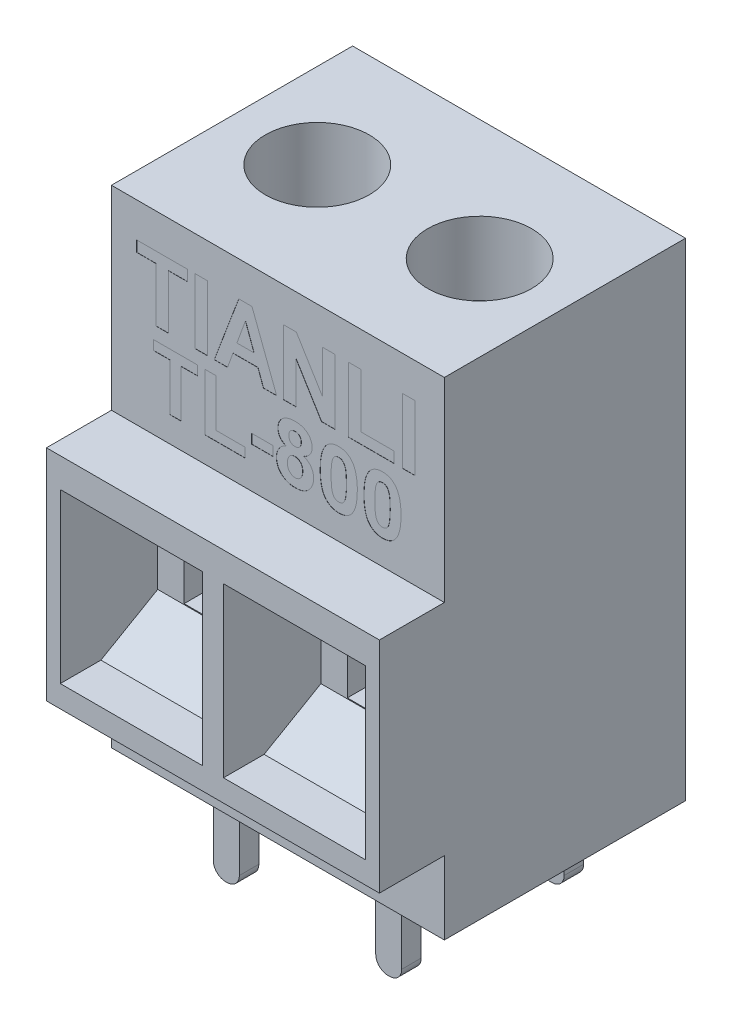
from build123d import *
from OCP.BRepFilletAPI import BRepFilletAPI_MakeChamfer

# Parameters (mm, degrees)
BOSS_EXTRUDE1_DEPTH     = 10.25
SKETCH2_W               = 8.75
SKETCH2_H               = 10.35
CUT_EXTRUDE1_DEPTH      = 6
SKETCH4_W               = 5.5
SKETCH4_H               = 6.2
CUT_EXTRUDE2_DEPTH      = 6
CHAMFER1_SIZE           = 3.5
CHAMFER1_SIZE2          = 2.020725942
SKETCH5_R               = 3.2
CUT_EXTRUDE3_DEPTH      = 4.5
SKETCH6_W               = 4.444559532
SKETCH6_H               = 1
SKETCH6_W_2             = 1
SKETCH6_H_2             = 3.5
CUT_EXTRUDE_THIN1_DEPTH = 1.5
SKETCH7_W               = 1.6
SKETCH7_H               = 1.2
BOSS_EXTRUDE2_DEPTH     = 5.45
FILLET1_R               = 0.75
SKETCH8_W               = 0.76923077
SKETCH8_H               = 4
SKETCH8_W_2             = 0.769230769
SKETCH8_W_3             = 1.301282051
SKETCH8_H_2             = 0.583333333
CUT_EXTRUDE4_DEPTH      = 0.01


with BuildPart() as part:
    # Sketch1 → Boss-Extrude1 (new, symmetric)
    with BuildSketch(Plane(origin=(0, 0, 0), x_dir=(0, 0, -1), z_dir=(1, 0, 0))):
        Polygon((7.425, 15), (-7.425, 15), (-7.425, 3), (-11.425, 3), (-11.425, -10.5), (-7.425, -10.5), (-7.425, -15), (7.425, -15), align=None)
    extrude(amount=BOSS_EXTRUDE1_DEPTH, both=True)

    # Sketch2 → Cut-Extrude1 (cut)
    with BuildSketch(Plane.XY.offset(11.425)):
        with Locations((5.025, -3.975)):
            Rectangle(SKETCH2_W, SKETCH2_H)
        with Locations((-5.025, -3.975)):
            Rectangle(SKETCH2_W, SKETCH2_H)
    extrude(amount=-CUT_EXTRUDE1_DEPTH, mode=Mode.SUBTRACT)

    # Sketch4 → Cut-Extrude2 (cut)
    with BuildSketch(Plane.XY.offset(5.425)):
        with Locations((-5.025, -3.975)):
            Rectangle(SKETCH4_W, SKETCH4_H)
        with Locations((5.025, -3.975)):
            Rectangle(SKETCH4_W, SKETCH4_H)
    extrude(amount=-CUT_EXTRUDE2_DEPTH, mode=Mode.SUBTRACT)

    # Chamfer1: one chamfer whose edges measure the first distance from different faces: ONE call of the kernel's chamfer builder (chamfer() names one face for all edges)
    chamfer1_edges_1 = [part.edges().sort_by_distance(p)[0] for p in [
        (5.025, -9.15, 5.425),
    ]]
    chamfer1_side_1 = [part.faces().sort_by_distance(p)[0] for p in [
        (5.025, -9.15, 8.425),
    ]]
    chamfer1_edges_2 = [part.edges().sort_by_distance(p)[0] for p in [
        (5.025, 1.2, 5.425),
    ]]
    chamfer1_side_2 = [part.faces().sort_by_distance(p)[0] for p in [
        (5.025, 1.2, 8.425),
    ]]
    chamfer1_edges_3 = [part.edges().sort_by_distance(p)[0] for p in [
        (-5.025, 1.2, 5.425),
    ]]
    chamfer1_side_3 = [part.faces().sort_by_distance(p)[0] for p in [
        (-5.025, 1.2, 8.425),
    ]]
    chamfer1_edges_4 = [part.edges().sort_by_distance(p)[0] for p in [
        (-5.025, -9.15, 5.425),
    ]]
    chamfer1_side_4 = [part.faces().sort_by_distance(p)[0] for p in [
        (-5.025, -9.15, 8.425),
    ]]
    chamfer1 = BRepFilletAPI_MakeChamfer(part.part.solid().wrapped)
    for e in chamfer1_edges_1:
        chamfer1.Add(CHAMFER1_SIZE, CHAMFER1_SIZE2, e.wrapped, chamfer1_side_1[0].wrapped)  # the first distance lies on this face
    for e in chamfer1_edges_2:
        chamfer1.Add(CHAMFER1_SIZE, CHAMFER1_SIZE2, e.wrapped, chamfer1_side_2[0].wrapped)  # the first distance lies on this face
    for e in chamfer1_edges_3:
        chamfer1.Add(CHAMFER1_SIZE, CHAMFER1_SIZE2, e.wrapped, chamfer1_side_3[0].wrapped)  # the first distance lies on this face
    for e in chamfer1_edges_4:
        chamfer1.Add(CHAMFER1_SIZE, CHAMFER1_SIZE2, e.wrapped, chamfer1_side_4[0].wrapped)  # the first distance lies on this face
    add(Compound.cast(chamfer1.Shape()), mode=Mode.REPLACE)

    # Sketch5 → Cut-Extrude3 (cut)
    with BuildSketch(Plane(origin=(0, 15, 0), x_dir=(1, 0, 0), z_dir=(0, 1, 0))):
        with Locations((-5, 0)):
            Circle(SKETCH5_R)
        with Locations((5, 0)):
            Circle(SKETCH5_R)
    extrude(amount=-CUT_EXTRUDE3_DEPTH, mode=Mode.SUBTRACT)

    # Sketch6 → Cut-Extrude-Thin1 (cut)
    with BuildSketch(Plane(origin=(0, 10.5, 0), x_dir=(1, 0, 0), z_dir=(0, 1, 0))):
        with Locations((-5, 0)):
            Rectangle(SKETCH6_W, SKETCH6_H)
        with Locations((-5, 0)):
            Rectangle(SKETCH6_W_2, SKETCH6_H_2)
        with Locations((5, 0)):
            Rectangle(SKETCH6_W_2, SKETCH6_H_2)
        with Locations((5, 0)):
            Rectangle(SKETCH6_W, SKETCH6_H)
    extrude(amount=-CUT_EXTRUDE_THIN1_DEPTH, mode=Mode.SUBTRACT)

    # Sketch7 → Boss-Extrude2 (add)
    with BuildSketch(Plane.XZ.offset(15)):
        with Locations((-5, 5)):
            Rectangle(SKETCH7_W, SKETCH7_H)
        with Locations((5, 5)):
            Rectangle(SKETCH7_W, SKETCH7_H)
        with Locations((-5, -5)):
            Rectangle(SKETCH7_W, SKETCH7_H)
        with Locations((5, -5)):
            Rectangle(SKETCH7_W, SKETCH7_H)
    extrude(amount=BOSS_EXTRUDE2_DEPTH)

    # Fillet1
    fillet1_edges = [part.edges().sort_by_distance(p)[0] for p in [
        (4.2, -20.45, -5),
        (5.8, -20.45, -5),
        (-4.2, -20.45, -5),
        (-5.8, -20.45, -5),
        (-5.8, -20.45, 5),
        (-4.2, -20.45, 5),
        (4.2, -20.45, 5),
        (5.8, -20.45, 5),
    ]]
    fillet(fillet1_edges, radius=FILLET1_R)

    # Sketch8 → Cut-Extrude4 (cut)
    # profile 1 of 12: a face of its own
    with BuildSketch(Plane.XY.offset(7.425)):
        Polygon((-7.512820513, 8.861293986), (-7.512820513, 12.194627319), (-8.692307692, 12.194627319), (-8.692307692, 12.861293986), (-5.564102564, 12.861293986), (-5.564102564, 12.194627319), (-6.743589744, 12.194627319), (-6.743589744, 8.861293986), align=None)
    # profile 2 of 12: a face of its own
    with BuildSketch(Plane.XY.offset(7.425)):
        with Locations((-4.717948718, 10.861293986)):
            Rectangle(SKETCH8_W, SKETCH8_H)
    # profile 3 of 12: a face of its own
    with BuildSketch(Plane.XY.offset(7.425)):
        Polygon((-0.076923077, 8.861293986), (-0.892628205, 8.861293986), (-1.229967949, 9.784370909), (-2.765224359, 9.784370909), (-3.102564103, 8.861293986), (-3.923076923, 8.861293986), (-2.411057692, 12.861293986), (-1.596153846, 12.861293986), align=None)
        Polygon((-1.474358974, 10.451037576), (-2, 11.886935012), (-2.524038462, 10.451037576), align=None, mode=Mode.SUBTRACT)
    # profile 4 of 12: a face of its own
    with BuildSketch(Plane.XY.offset(7.425)):
        Polygon((0.333333333, 8.861293986), (0.333333333, 12.861293986), (1.137019231, 12.861293986), (2.743589744, 10.231486294), (2.743589744, 12.861293986), (3.512820513, 12.861293986), (3.512820513, 8.861293986), (2.684294872, 8.861293986), (1.102564103, 11.449435012), (1.102564103, 8.861293986), align=None)
    # profile 5 of 12: a face of its own
    with BuildSketch(Plane.XY.offset(7.425)):
        Polygon((4.333333333, 8.861293986), (4.333333333, 12.861293986), (5.102564103, 12.861293986), (5.102564103, 9.527960653), (7.153846154, 9.527960653), (7.153846154, 8.861293986), align=None)
    # profile 6 of 12: a face of its own
    with BuildSketch(Plane.XY.offset(7.425)):
        with Locations((8.051282052, 10.861293986)):
            Rectangle(SKETCH8_W_2, SKETCH8_H)
    # profile 7 of 12: a face of its own
    with BuildSketch(Plane.XY.offset(7.425)):
        Polygon((-6.641025641, 4.564745346), (-6.641025641, 7.481412013), (-7.673076923, 7.481412013), (-7.673076923, 8.064745346), (-4.935897436, 8.064745346), (-4.935897436, 7.481412013), (-5.967948718, 7.481412013), (-5.967948718, 4.564745346), align=None)
    # profile 8 of 12: a face of its own
    with BuildSketch(Plane.XY.offset(7.425)):
        Polygon((-4.487179487, 4.564745346), (-4.487179487, 8.064745346), (-3.814102564, 8.064745346), (-3.814102564, 5.14807868), (-2.019230769, 5.14807868), (-2.019230769, 4.564745346), align=None)
    # profile 9 of 12: a face of its own
    with BuildSketch(Plane.XY.offset(7.425)):
        with Locations((-0.96474359, 5.798719705)):
            Rectangle(SKETCH8_W_3, SKETCH8_H_2)
    # profile 10 of 12: a face of its own
    with BuildSketch(Plane.XY.offset(7.425)):
        with BuildLine():
            add(Edge.make_bspline(
                [(0.505508814, 6.467589898), (0.484108403, 6.476651492), (0.442102019, 6.494438289), (0.382460985, 6.525535645), (0.327170175, 6.558701255), (0.277098211, 6.59525645), (0.230170324, 6.632557978), (0.189165573, 6.674408494), (0.151660805, 6.717636029), (0.108878396, 6.778603764), (0.065235353, 6.859081875), (0.027728374, 6.961355467), (0.004414915, 7.068340181), (0.001484224, 7.141484222), (0, 7.178527398)],
                knots=[0, 0, 0, 0, 0.898135024, 1.762928937, 2.598141881, 3.387992021, 4.158483993, 4.912374357, 5.649344587, 6.368826796, 7.78793972, 9.174346042, 10.568971657, 12, 12, 12, 12], degree=3))
            add(Edge.make_bspline(
                [(0, 7.178527398), (0.000794324, 7.209883646), (0.002354104, 7.271456563), (0.015052406, 7.361780572), (0.037092733, 7.447908544), (0.067024117, 7.530084069), (0.105968392, 7.607868176), (0.153525204, 7.681185276), (0.208814476, 7.751060563), (0.273687797, 7.8152257), (0.345689766, 7.874508393), (0.425821831, 7.925594708), (0.513225967, 7.968513765), (0.607403672, 8.004630911), (0.709306049, 8.031323985), (0.818012205, 8.051268479), (0.93390967, 8.062075882), (1.013567998, 8.063839437), (1.054487179, 8.064745346)],
                knots=[0, 0, 0, 0, 0.969401132, 1.903571386, 2.813295953, 3.714164367, 4.602979607, 5.497068024, 6.412430398, 7.352730811, 8.313282239, 9.291613189, 10.283859467, 11.320059661, 12.405231593, 13.536450991, 14.734515125, 16, 16, 16, 16], degree=3))
            add(Edge.make_bspline(
                [(1.054487179, 8.064745346), (1.095175168, 8.063857122), (1.174139354, 8.062133324), (1.289304373, 8.051112407), (1.397154582, 8.031549594), (1.498481383, 8.004401323), (1.592361957, 7.968310955), (1.680140287, 7.926034105), (1.759924081, 7.874050908), (1.832494647, 7.815292758), (1.898034509, 7.75106985), (1.953981151, 7.681183548), (2.002393932, 7.60807055), (2.041194259, 7.530057944), (2.071253709, 7.447924084), (2.092986737, 7.361711699), (2.106863059, 7.271525634), (2.108262218, 7.209895664), (2.108974359, 7.178527398)],
                knots=[0, 0, 0, 0, 1.259437241, 2.444221022, 3.576496957, 4.648717845, 5.68588583, 6.685544666, 7.658705287, 8.625770615, 9.572078176, 10.492824823, 11.391686538, 12.281331915, 13.183041723, 14.093615956, 15.029693465, 16, 16, 16, 16], degree=3))
            add(Edge.make_bspline(
                [(2.108974359, 7.178527398), (2.107438833, 7.139582302), (2.104417221, 7.062946027), (2.07806347, 6.951824743), (2.036587193, 6.846867631), (1.977022876, 6.750332445), (1.903280867, 6.661923124), (1.814179219, 6.585333091), (1.712646687, 6.518269782), (1.637210264, 6.484759896), (1.598557692, 6.467589898)],
                knots=[0, 0, 0, 0, 1.001685467, 1.971119642, 2.924446479, 3.896772127, 4.879289176, 5.877460772, 6.912440485, 8, 8, 8, 8], degree=3))
            add(Edge.make_bspline(
                [(1.598557692, 6.467589898), (1.622551724, 6.457652114), (1.6696341, 6.438151662), (1.736541113, 6.403444108), (1.798855918, 6.365426657), (1.857675401, 6.32511941), (1.910743328, 6.279790233), (1.960004265, 6.232087998), (2.005463682, 6.181348936), (2.045678623, 6.126899753), (2.081666206, 6.069663528), (2.11324535, 6.01054457), (2.139276996, 5.948680689), (2.160948834, 5.885225403), (2.178087393, 5.819398926), (2.189509769, 5.751339299), (2.197945057, 5.681140544), (2.198458268, 5.633514977), (2.198717949, 5.609416821)],
                knots=[0, 0, 0, 0, 1.114643742, 2.187213659, 3.231772812, 4.247796845, 5.244764516, 6.224002375, 7.19061506, 8.165938012, 9.126385546, 10.091434554, 11.040068535, 12.004700134, 12.968444139, 13.956586669, 14.966049226, 16, 16, 16, 16], degree=3))
            add(Edge.make_bspline(
                [(2.198717949, 5.609416821), (2.197719664, 5.570118436), (2.195758173, 5.492902529), (2.181998389, 5.37983852), (2.157145773, 5.272647891), (2.12323776, 5.171061405), (2.080955843, 5.074351961), (2.026830988, 4.984390815), (1.964224565, 4.89956236), (1.892143942, 4.821455091), (1.812332422, 4.750691643), (1.725834459, 4.688503658), (1.63249613, 4.636576264), (1.533084848, 4.593266483), (1.426862764, 4.560845715), (1.314573609, 4.536688374), (1.195996187, 4.52277893), (1.11481921, 4.520854862), (1.073417468, 4.519873552)],
                knots=[0, 0, 0, 0, 1.069671731, 2.10175744, 3.09402022, 4.059639235, 5.013663234, 5.960662081, 6.911094837, 7.879078902, 8.847982309, 9.810095429, 10.772776236, 11.750101161, 12.756155452, 13.790512928, 14.873121219, 16, 16, 16, 16], degree=3))
            add(Edge.make_bspline(
                [(1.073417468, 4.519873552), (1.034597226, 4.520770406), (0.958662864, 4.522524698), (0.847028445, 4.533674014), (0.740570552, 4.553196746), (0.638879236, 4.58084052), (0.541825947, 4.615356932), (0.450617855, 4.659626106), (0.363246148, 4.709582851), (0.309960809, 4.749944182), (0.283253205, 4.770174032)],
                knots=[0, 0, 0, 0, 1.102600357, 2.156742264, 3.182669202, 4.172953404, 5.147246686, 6.10327948, 7.049328352, 8, 8, 8, 8], degree=3))
            add(Edge.make_bspline(
                [(0.283253205, 4.770174032), (0.253338031, 4.795142658), (0.19428384, 4.844432092), (0.11901138, 4.930186132), (0.05395269, 5.021492989), (0.001361065, 5.120036697), (-0.039666087, 5.225762655), (-0.068786506, 5.337973729), (-0.086942647, 5.457149987), (-0.088793453, 5.53877004), (-0.08974359, 5.580670827)],
                knots=[0, 0, 0, 0, 1.009349607, 1.992511403, 2.949479119, 3.912246635, 4.881480856, 5.884237694, 6.913844069, 8, 8, 8, 8], degree=3))
            add(Edge.make_bspline(
                [(-0.08974359, 5.580670827), (-0.087977136, 5.627070679), (-0.084485744, 5.718779857), (-0.057040851, 5.853402627), (-0.011727374, 5.981809766), (0.040044572, 6.083451901), (0.091032965, 6.159725119), (0.134899725, 6.214165172), (0.184008604, 6.265200512), (0.237975107, 6.313066457), (0.297612752, 6.356749234), (0.362236364, 6.397124474), (0.431371092, 6.435488691), (0.480539322, 6.456778252), (0.505508814, 6.467589898)],
                knots=[0, 0, 0, 0, 1.466730477, 2.898988729, 4.325053486, 5.763136659, 6.492982434, 7.22372602, 7.971323195, 8.73066801, 9.502396106, 10.306304791, 11.139877329, 12, 12, 12, 12], degree=3))
        make_face()
        with BuildLine():
            add(Edge.make_bspline(
                [(0.673076923, 7.125943263), (0.674112516, 7.095679409), (0.676095978, 7.037715305), (0.695883879, 6.956035983), (0.728635779, 6.884689602), (0.773688539, 6.824204433), (0.830816132, 6.776586406), (0.897121406, 6.742481937), (0.972253521, 6.722469123), (1.024915565, 6.719920729), (1.052383814, 6.7185915)],
                knots=[0, 0, 0, 0, 1.15281608, 2.207978909, 3.181172827, 4.129718639, 5.059990565, 5.992992319, 6.953155196, 8, 8, 8, 8], degree=3))
            add(Edge.make_bspline(
                [(1.052383814, 6.7185915), (1.080097238, 6.719875088), (1.133528459, 6.722349832), (1.209240254, 6.743091825), (1.276402828, 6.777368253), (1.333615976, 6.825597286), (1.379821791, 6.886134253), (1.41293287, 6.957627658), (1.433002389, 7.039558876), (1.43489943, 7.097542344), (1.435897436, 7.128046629)],
                knots=[0, 0, 0, 0, 1.048069097, 2.020667378, 2.946900928, 3.882892544, 4.829907216, 5.807806237, 6.846717784, 8, 8, 8, 8], degree=3))
            add(Edge.make_bspline(
                [(1.435897436, 7.128046629), (1.434905319, 7.156932385), (1.433007885, 7.212176705), (1.412503017, 7.29033367), (1.380352924, 7.360021795), (1.334086941, 7.418805906), (1.278567052, 7.467773042), (1.212402503, 7.501428183), (1.138280261, 7.52266458), (1.085958423, 7.525043941), (1.05869391, 7.526283808)],
                knots=[0, 0, 0, 0, 1.120059371, 2.14212559, 3.117108277, 4.081714894, 5.028368956, 5.970787798, 6.942592912, 8, 8, 8, 8], degree=3))
            add(Edge.make_bspline(
                [(1.05869391, 7.526283808), (1.030509428, 7.525033183), (0.976602895, 7.522641198), (0.900122314, 7.50173721), (0.832606142, 7.466980736), (0.775768876, 7.417933044), (0.729501841, 7.358408334), (0.696137583, 7.288944236), (0.67611445, 7.210250428), (0.674117042, 7.154811958), (0.673076923, 7.125943263)],
                knots=[0, 0, 0, 0, 1.078082589, 2.061974896, 3.011033917, 3.963675658, 4.914590949, 5.879605178, 6.895838403, 8, 8, 8, 8], degree=3))
        make_face(mode=Mode.SUBTRACT)
        with BuildLine():
            add(Edge.make_bspline(
                [(0.583333333, 5.644472911), (0.583702502, 5.622019166), (0.584419323, 5.578420367), (0.590960264, 5.514938606), (0.601045151, 5.45499348), (0.616812761, 5.399136098), (0.635396635, 5.346449839), (0.659504456, 5.298344316), (0.686880221, 5.253336342), (0.719196008, 5.212872976), (0.754797654, 5.176889356), (0.792135275, 5.144571152), (0.832191537, 5.118225172), (0.874038296, 5.095916213), (0.918371537, 5.079114208), (0.964778866, 5.06758085), (1.013044882, 5.059047444), (1.046034073, 5.058576085), (1.062900641, 5.05833509)],
                knots=[0, 0, 0, 0, 1.266244622, 2.458687606, 3.596609786, 4.690452447, 5.728949622, 6.743059962, 7.719893583, 8.695837149, 9.65607124, 10.572687906, 11.475837526, 12.354503287, 13.243297811, 14.141816854, 15.049956288, 16, 16, 16, 16], degree=3))
            add(Edge.make_bspline(
                [(1.062900641, 5.05833509), (1.07928637, 5.058662136), (1.111283498, 5.059300774), (1.158322028, 5.066598956), (1.203093294, 5.078639209), (1.246159745, 5.094452248), (1.286339819, 5.115967832), (1.324649951, 5.141503517), (1.361184748, 5.171473769), (1.394639198, 5.206855532), (1.425803227, 5.245884879), (1.452249707, 5.289959163), (1.475862541, 5.337526709), (1.493381849, 5.389865736), (1.508876621, 5.445627287), (1.517770819, 5.505906887), (1.524620996, 5.569997432), (1.525294344, 5.614069546), (1.525641026, 5.636760571)],
                knots=[0, 0, 0, 0, 0.942317584, 1.840104704, 2.730710625, 3.607499931, 4.473808274, 5.346669015, 6.254175223, 7.186360584, 8.144194921, 9.122212144, 10.13877185, 11.193666142, 12.293061794, 13.46493029, 14.694790812, 16, 16, 16, 16], degree=3))
            add(Edge.make_bspline(
                [(1.525641026, 5.636760571), (1.525254928, 5.656642889), (1.524498867, 5.695576621), (1.518055821, 5.752557472), (1.507602495, 5.806740353), (1.49305582, 5.857990481), (1.473951945, 5.905753674), (1.451309804, 5.950788323), (1.424128991, 5.992721931), (1.392363184, 6.03103012), (1.358419335, 6.066100813), (1.321469698, 6.096608976), (1.282290265, 6.122589968), (1.240670109, 6.143831887), (1.19678822, 6.15985185), (1.151078587, 6.171945258), (1.102860841, 6.179149747), (1.069936562, 6.17979811), (1.053084936, 6.180129962)],
                knots=[0, 0, 0, 0, 1.18097333, 2.312592441, 3.401847494, 4.45657129, 5.472467779, 6.453609222, 7.447247299, 8.433973197, 9.406033457, 10.342947316, 11.274909381, 12.193955836, 13.112162788, 14.045055317, 14.999401151, 16, 16, 16, 16], degree=3))
            add(Edge.make_bspline(
                [(1.053084936, 6.180129962), (1.033897588, 6.179561277), (0.996762882, 6.17846066), (0.942834369, 6.17083334), (0.892835803, 6.157302124), (0.846153853, 6.139379223), (0.803502765, 6.115126488), (0.764882819, 6.085359205), (0.729471501, 6.051007054), (0.688955949, 5.998194641), (0.646630049, 5.927177997), (0.610886966, 5.835851566), (0.586927403, 5.741521383), (0.584533073, 5.676868755), (0.583333333, 5.644472911)],
                knots=[0, 0, 0, 0, 0.864439711, 1.673014741, 2.446909759, 3.19383146, 3.919980361, 4.648644137, 5.385779273, 6.135663785, 7.641703236, 9.092511638, 10.543128981, 12, 12, 12, 12], degree=3))
        make_face(mode=Mode.SUBTRACT)
    # profile 11 of 12: a face of its own
    with BuildSketch(Plane.XY.offset(7.425)):
        with BuildLine():
            add(Edge.make_bspline(
                [(3.746794872, 8.064745346), (3.788456533, 8.063740494), (3.869567011, 8.061784162), (3.98775391, 8.044454601), (4.099032757, 8.016667616), (4.203395386, 7.977388743), (4.300744027, 7.926382857), (4.39043024, 7.863431988), (4.474413789, 7.790423154), (4.52291122, 7.733767089), (4.547475962, 7.705069866)],
                knots=[0, 0, 0, 0, 1.098584764, 2.138818609, 3.143716932, 4.11936356, 5.073598562, 6.034819447, 7.004603936, 8, 8, 8, 8], degree=3))
            add(Edge.make_bspline(
                [(4.547475962, 7.705069866), (4.561527386, 7.686793526), (4.590203881, 7.649494718), (4.628824673, 7.589223966), (4.665953311, 7.525289992), (4.698362987, 7.456153883), (4.729396658, 7.383015379), (4.758156045, 7.30570783), (4.783126925, 7.223592495), (4.806623063, 7.137719359), (4.825770261, 7.046747292), (4.843464042, 6.951658394), (4.858132983, 6.852021581), (4.869700308, 6.748155637), (4.880031075, 6.640218589), (4.885691835, 6.527695373), (4.890326792, 6.410837242), (4.890790011, 6.331343835), (4.891025641, 6.290907205)],
                knots=[0, 0, 0, 0, 0.746761706, 1.524009783, 2.317797294, 3.140957436, 3.996208027, 4.892396322, 5.812273159, 6.776774596, 7.776522781, 8.823794876, 9.910947555, 11.039215469, 12.21036455, 13.424061321, 14.689674014, 16, 16, 16, 16], degree=3))
            add(Edge.make_bspline(
                [(4.891025641, 6.290907205), (4.89079356, 6.250470483), (4.890338659, 6.171210463), (4.885674556, 6.054586773), (4.880026029, 5.942298163), (4.869724408, 5.83435535), (4.858046331, 5.730510054), (4.843796784, 5.630984931), (4.82477152, 5.536332969), (4.805925531, 5.445505996), (4.782567142, 5.359267237), (4.756474117, 5.27729916), (4.728870643, 5.199027899), (4.697115437, 5.125795241), (4.663542892, 5.056573578), (4.626966798, 4.991987021), (4.587914771, 4.931342746), (4.558960849, 4.893847166), (4.544671474, 4.875342302)],
                knots=[0, 0, 0, 0, 1.308387162, 2.564569672, 3.776470597, 4.945886788, 6.07248526, 7.158029334, 8.197718558, 9.195987466, 10.159061779, 11.087054987, 11.979325145, 12.84323098, 13.668471539, 14.467659354, 15.243757377, 16, 16, 16, 16], degree=3))
            add(Edge.make_bspline(
                [(4.544671474, 4.875342302), (4.520331485, 4.846891055), (4.472283171, 4.790726921), (4.389229122, 4.718323557), (4.299691589, 4.656674595), (4.202514412, 4.606682328), (4.098661735, 4.567132426), (3.987200783, 4.540232125), (3.869336759, 4.522867284), (3.788224796, 4.520885696), (3.746794872, 4.519873552)],
                knots=[0, 0, 0, 0, 0.991631672, 1.957528776, 2.911425699, 3.867574088, 4.848108326, 5.850523106, 6.902101959, 8, 8, 8, 8], degree=3))
            add(Edge.make_bspline(
                [(3.746794872, 4.519873552), (3.704891418, 4.521079309), (3.622779428, 4.523442053), (3.502892364, 4.542172196), (3.388934207, 4.57217777), (3.281314065, 4.615017729), (3.180185923, 4.670535173), (3.084759728, 4.737085278), (2.997111567, 4.817681451), (2.928492621, 4.892712042), (2.878290793, 4.960507699), (2.842883757, 5.016726283), (2.80866663, 5.076882412), (2.779133137, 5.142856868), (2.749995722, 5.212698325), (2.724189129, 5.287911962), (2.701421028, 5.367851015), (2.68004323, 5.452150458), (2.662217296, 5.541390952), (2.645820053, 5.635309143), (2.632898142, 5.734304442), (2.621441536, 5.837825458), (2.613375429, 5.946116564), (2.606824722, 6.059000546), (2.603539994, 6.176838743), (2.602893755, 6.257018133), (2.602564103, 6.297918423)],
                knots=[0, 0, 0, 0, 1.257818097, 2.464759732, 3.634271214, 4.790227596, 5.933394726, 7.09190477, 8.274482889, 9.50191983, 10.139172818, 10.805000628, 11.49619854, 12.215266328, 12.973768034, 13.768328009, 14.601232062, 15.469317089, 16.379095881, 17.333267023, 18.331755967, 19.376479622, 20.460535752, 21.592206075, 22.771760786, 24, 24, 24, 24], degree=3))
            add(Edge.make_bspline(
                [(2.602564103, 6.297918423), (2.60279433, 6.338121598), (2.603245546, 6.416914652), (2.607943662, 6.533068671), (2.613517543, 6.644896196), (2.62393129, 6.752592957), (2.635445574, 6.855994824), (2.649959143, 6.955238123), (2.668511381, 7.049809386), (2.688710751, 7.140086066), (2.71086808, 7.226387875), (2.737203674, 7.307993425), (2.764531254, 7.386136958), (2.796657613, 7.458978992), (2.830024042, 7.528054966), (2.866628757, 7.592629419), (2.90567358, 7.653276741), (2.934628434, 7.690771927), (2.948918269, 7.709276596)],
                knots=[0, 0, 0, 0, 1.304469132, 2.556591843, 3.77188756, 4.93702727, 6.066781583, 7.147865049, 8.190466662, 9.19316792, 10.149665317, 11.080258032, 11.975027628, 12.834388201, 13.661940433, 14.463366943, 15.241638981, 16, 16, 16, 16], degree=3))
            add(Edge.make_bspline(
                [(2.948918269, 7.709276596), (2.97325692, 7.73773058), (3.021302592, 7.793900117), (3.104375985, 7.866263927), (3.19401251, 7.928178993), (3.291474082, 7.977572877), (3.395088686, 8.01766499), (3.50640377, 8.044350631), (3.624249015, 8.061761303), (3.705363605, 8.063736478), (3.746794872, 8.064745346)],
                knots=[0, 0, 0, 0, 0.991667276, 1.957599061, 2.911530233, 3.873218945, 4.847995157, 5.850445929, 6.902062539, 8, 8, 8, 8], degree=3))
        make_face()
        with BuildLine():
            add(Edge.make_bspline(
                [(3.746794872, 7.481412013), (3.725452438, 7.480434019), (3.683235155, 7.478499458), (3.621873273, 7.464162481), (3.563922037, 7.440503343), (3.509102083, 7.407475494), (3.458624795, 7.361529211), (3.415866009, 7.29992511), (3.378938616, 7.224326659), (3.360458483, 7.167819935), (3.350661058, 7.137862334)],
                knots=[0, 0, 0, 0, 0.899391665, 1.779078861, 2.640979247, 3.529945348, 4.464599804, 5.495588918, 6.672261578, 8, 8, 8, 8], degree=3))
            add(Edge.make_bspline(
                [(3.350661058, 7.137862334), (3.344542397, 7.115258495), (3.331391774, 7.066676862), (3.316466364, 6.987468612), (3.304157686, 6.897575632), (3.293764252, 6.797018814), (3.285306186, 6.685744947), (3.280097418, 6.563683227), (3.276497212, 6.430919183), (3.275934016, 6.338819924), (3.275641026, 6.290907205)],
                knots=[0, 0, 0, 0, 0.658986521, 1.416336438, 2.266694271, 3.212608458, 4.261595115, 5.407496572, 6.651304179, 8, 8, 8, 8], degree=3))
            add(Edge.make_bspline(
                [(3.275641026, 6.290907205), (3.276040466, 6.243231511), (3.276806127, 6.151845201), (3.278980348, 6.020677789), (3.285151914, 5.901278479), (3.291329055, 5.793171452), (3.301617356, 5.696697341), (3.311965247, 5.611595637), (3.326228113, 5.538447547), (3.345688969, 5.458885851), (3.375121019, 5.375611914), (3.415500913, 5.291600731), (3.458801971, 5.224143686), (3.509802853, 5.175844893), (3.565000751, 5.143444877), (3.622252038, 5.119638883), (3.683558042, 5.106280485), (3.725467058, 5.104243515), (3.746794872, 5.103206885)],
                knots=[0, 0, 0, 0, 1.613353868, 3.092528792, 4.438413522, 5.658843895, 6.755779493, 7.721003256, 8.558527904, 9.275869043, 10.491421475, 11.538327284, 12.426656321, 13.187490948, 13.890032692, 14.581719216, 15.278226227, 16, 16, 16, 16], degree=3))
            add(Edge.make_bspline(
                [(3.746794872, 5.103206885), (3.768382753, 5.104135276), (3.810629413, 5.105952102), (3.872071689, 5.120767106), (3.930105438, 5.143714835), (3.984558578, 5.177416082), (4.034988589, 5.223047761), (4.077716161, 5.284707221), (4.114653425, 5.360288165), (4.133132056, 5.416797552), (4.142928686, 5.446756564)],
                knots=[0, 0, 0, 0, 0.909107913, 1.77908945, 2.650019014, 3.530482969, 4.465025013, 5.495890128, 6.672421267, 8, 8, 8, 8], degree=3))
            add(Edge.make_bspline(
                [(4.142928686, 5.446756564), (4.149038496, 5.469362197), (4.162110234, 5.517726206), (4.177141999, 5.596441365), (4.189484001, 5.685868523), (4.199778615, 5.785967907), (4.208319876, 5.897001413), (4.213484428, 6.01883292), (4.217088021, 6.151362552), (4.217654638, 6.243228161), (4.217948718, 6.290907205)],
                knots=[0, 0, 0, 0, 0.66114423, 1.414496391, 2.261103113, 3.210114492, 4.255954433, 5.405607896, 6.653488082, 8, 8, 8, 8], degree=3))
            add(Edge.make_bspline(
                [(4.217948718, 6.290907205), (4.217981234, 6.338587892), (4.218043567, 6.429990969), (4.213913777, 6.561324873), (4.209860748, 6.68107589), (4.201595932, 6.789009435), (4.193317991, 6.885490029), (4.180985913, 6.970034625), (4.168562316, 7.04357506), (4.147330358, 7.12297096), (4.118475955, 7.206484211), (4.079055383, 7.291368365), (4.034494512, 7.358193069), (3.983863286, 7.407312575), (3.928937075, 7.440424748), (3.871545285, 7.464302981), (3.810344022, 7.478475811), (3.768133757, 7.480426079), (3.746794872, 7.481412013)],
                knots=[0, 0, 0, 0, 1.611146624, 3.088541111, 4.440175916, 5.659517762, 6.746360572, 7.711365618, 8.546319149, 9.264661039, 10.486047304, 11.528122518, 12.419721574, 13.184982167, 13.89070983, 14.574167459, 15.279187713, 16, 16, 16, 16], degree=3))
        make_face(mode=Mode.SUBTRACT)
    # profile 12 of 12: a face of its own
    with BuildSketch(Plane.XY.offset(7.425)):
        with BuildLine():
            add(Edge.make_bspline(
                [(6.439102564, 8.064745346), (6.480764225, 8.063740494), (6.561874704, 8.061784162), (6.680061602, 8.044454601), (6.791340449, 8.016667616), (6.895703078, 7.977388743), (6.993051719, 7.926382857), (7.082737932, 7.863431988), (7.166721482, 7.790423154), (7.215218913, 7.733767089), (7.239783654, 7.705069866)],
                knots=[0, 0, 0, 0, 1.098584764, 2.138818609, 3.143716932, 4.11936356, 5.073598562, 6.034819447, 7.004603936, 8, 8, 8, 8], degree=3))
            add(Edge.make_bspline(
                [(7.239783654, 7.705069866), (7.253835078, 7.686793526), (7.282511573, 7.649494718), (7.321132366, 7.589223966), (7.358261003, 7.525289992), (7.39067068, 7.456153883), (7.42170435, 7.383015379), (7.450463737, 7.30570783), (7.475434618, 7.223592495), (7.498930756, 7.137719359), (7.518077953, 7.046747292), (7.535771734, 6.951658394), (7.550440675, 6.852021581), (7.562008, 6.748155637), (7.572338767, 6.640218589), (7.577999528, 6.527695373), (7.582634484, 6.410837242), (7.583097703, 6.331343835), (7.583333333, 6.290907205)],
                knots=[0, 0, 0, 0, 0.746761706, 1.524009783, 2.317797294, 3.140957436, 3.996208027, 4.892396322, 5.812273159, 6.776774596, 7.776522781, 8.823794876, 9.910947555, 11.039215469, 12.21036455, 13.424061321, 14.689674014, 16, 16, 16, 16], degree=3))
            add(Edge.make_bspline(
                [(7.583333333, 6.290907205), (7.583101253, 6.250470483), (7.582646351, 6.171210463), (7.577982248, 6.054586773), (7.572333721, 5.942298163), (7.562032101, 5.83435535), (7.550354024, 5.730510054), (7.536104476, 5.630984931), (7.517079212, 5.536332969), (7.498233223, 5.445505996), (7.474874835, 5.359267237), (7.448781809, 5.27729916), (7.421178336, 5.199027899), (7.38942313, 5.125795241), (7.355850585, 5.056573578), (7.31927449, 4.991987021), (7.280222464, 4.931342746), (7.251268542, 4.893847166), (7.236979167, 4.875342302)],
                knots=[0, 0, 0, 0, 1.308387162, 2.564569672, 3.776470597, 4.945886788, 6.07248526, 7.158029334, 8.197718558, 9.195987466, 10.159061779, 11.087054987, 11.979325145, 12.84323098, 13.668471539, 14.467659354, 15.243757377, 16, 16, 16, 16], degree=3))
            add(Edge.make_bspline(
                [(7.236979167, 4.875342302), (7.212639177, 4.846891055), (7.164590863, 4.790726921), (7.081536814, 4.718323557), (6.991999281, 4.656674595), (6.894822105, 4.606682328), (6.790969427, 4.567132426), (6.679508476, 4.540232125), (6.561644451, 4.522867284), (6.480532488, 4.520885696), (6.439102564, 4.519873552)],
                knots=[0, 0, 0, 0, 0.991631672, 1.957528776, 2.911425699, 3.867574088, 4.848108326, 5.850523106, 6.902101959, 8, 8, 8, 8], degree=3))
            add(Edge.make_bspline(
                [(6.439102564, 4.519873552), (6.39719911, 4.521079309), (6.315087121, 4.523442053), (6.195200056, 4.542172196), (6.0812419, 4.57217777), (5.973621758, 4.615017729), (5.872493615, 4.670535173), (5.777067421, 4.737085278), (5.689419259, 4.817681451), (5.620800313, 4.892712042), (5.570598485, 4.960507699), (5.535191449, 5.016726283), (5.500974323, 5.076882412), (5.471440829, 5.142856868), (5.442303414, 5.212698325), (5.416496821, 5.287911962), (5.39372872, 5.367851015), (5.372350922, 5.452150458), (5.354524988, 5.541390952), (5.338127745, 5.635309143), (5.325205834, 5.734304442), (5.313749228, 5.837825458), (5.305683122, 5.946116564), (5.299132414, 6.059000546), (5.295847686, 6.176838743), (5.295201447, 6.257018133), (5.294871795, 6.297918423)],
                knots=[0, 0, 0, 0, 1.257818097, 2.464759732, 3.634271214, 4.790227596, 5.933394726, 7.09190477, 8.274482889, 9.50191983, 10.139172818, 10.805000628, 11.49619854, 12.215266328, 12.973768034, 13.768328009, 14.601232062, 15.469317089, 16.379095881, 17.333267023, 18.331755967, 19.376479622, 20.460535752, 21.592206075, 22.771760786, 24, 24, 24, 24], degree=3))
            add(Edge.make_bspline(
                [(5.294871795, 6.297918423), (5.295102022, 6.338121598), (5.295553239, 6.416914652), (5.300251354, 6.533068671), (5.305825235, 6.644896196), (5.316238982, 6.752592957), (5.327753267, 6.855994824), (5.342266836, 6.955238123), (5.360819073, 7.049809386), (5.381018444, 7.140086066), (5.403175773, 7.226387875), (5.429511366, 7.307993425), (5.456838947, 7.386136958), (5.488965305, 7.458978992), (5.522331734, 7.528054966), (5.55893645, 7.592629419), (5.597981272, 7.653276741), (5.626936127, 7.690771927), (5.641225962, 7.709276596)],
                knots=[0, 0, 0, 0, 1.304469132, 2.556591843, 3.77188756, 4.93702727, 6.066781583, 7.147865049, 8.190466662, 9.19316792, 10.149665317, 11.080258032, 11.975027628, 12.834388201, 13.661940433, 14.463366943, 15.241638981, 16, 16, 16, 16], degree=3))
            add(Edge.make_bspline(
                [(5.641225962, 7.709276596), (5.665564612, 7.73773058), (5.713610284, 7.793900117), (5.796683677, 7.866263927), (5.886320202, 7.928178993), (5.983781775, 7.977572877), (6.087396378, 8.01766499), (6.198711462, 8.044350631), (6.316556707, 8.061761303), (6.397671298, 8.063736478), (6.439102564, 8.064745346)],
                knots=[0, 0, 0, 0, 0.991667276, 1.957599061, 2.911530233, 3.873218945, 4.847995157, 5.850445929, 6.902062539, 8, 8, 8, 8], degree=3))
        make_face()
        with BuildLine():
            add(Edge.make_bspline(
                [(6.439102564, 7.481412013), (6.41776013, 7.480434019), (6.375542847, 7.478499458), (6.314180965, 7.464162481), (6.256229729, 7.440503343), (6.201409776, 7.407475494), (6.150932487, 7.361529211), (6.108173701, 7.29992511), (6.071246308, 7.224326659), (6.052766176, 7.167819935), (6.04296875, 7.137862334)],
                knots=[0, 0, 0, 0, 0.899391665, 1.779078861, 2.640979247, 3.529945348, 4.464599804, 5.495588918, 6.672261578, 8, 8, 8, 8], degree=3))
            add(Edge.make_bspline(
                [(6.04296875, 7.137862334), (6.036850089, 7.115258495), (6.023699467, 7.066676862), (6.008774057, 6.987468612), (5.996465379, 6.897575632), (5.986071944, 6.797018814), (5.977613878, 6.685744947), (5.97240511, 6.563683227), (5.968804905, 6.430919183), (5.968241709, 6.338819924), (5.967948718, 6.290907205)],
                knots=[0, 0, 0, 0, 0.658986521, 1.416336438, 2.266694271, 3.212608458, 4.261595115, 5.407496572, 6.651304179, 8, 8, 8, 8], degree=3))
            add(Edge.make_bspline(
                [(5.967948718, 6.290907205), (5.968348158, 6.243231511), (5.969113819, 6.151845201), (5.971288041, 6.020677789), (5.977459606, 5.901278479), (5.983636747, 5.793171452), (5.993925048, 5.696697341), (6.004272939, 5.611595637), (6.018535805, 5.538447547), (6.037996662, 5.458885851), (6.067428711, 5.375611914), (6.107808605, 5.291600731), (6.151109663, 5.224143686), (6.202110546, 5.175844893), (6.257308444, 5.143444877), (6.31455973, 5.119638883), (6.375865734, 5.106280485), (6.41777475, 5.104243515), (6.439102564, 5.103206885)],
                knots=[0, 0, 0, 0, 1.613353868, 3.092528792, 4.438413522, 5.658843895, 6.755779493, 7.721003256, 8.558527904, 9.275869043, 10.491421475, 11.538327284, 12.426656321, 13.187490948, 13.890032692, 14.581719216, 15.278226227, 16, 16, 16, 16], degree=3))
            add(Edge.make_bspline(
                [(6.439102564, 5.103206885), (6.460690446, 5.104135276), (6.502937105, 5.105952102), (6.564379382, 5.120767106), (6.62241313, 5.143714835), (6.676866271, 5.177416082), (6.727296282, 5.223047761), (6.770023853, 5.284707221), (6.806961117, 5.360288165), (6.825439748, 5.416797552), (6.835236378, 5.446756564)],
                knots=[0, 0, 0, 0, 0.909107913, 1.77908945, 2.650019014, 3.530482969, 4.465025013, 5.495890128, 6.672421267, 8, 8, 8, 8], degree=3))
            add(Edge.make_bspline(
                [(6.835236378, 5.446756564), (6.841346188, 5.469362197), (6.854417926, 5.517726206), (6.869449692, 5.596441365), (6.881791693, 5.685868523), (6.892086308, 5.785967907), (6.900627569, 5.897001413), (6.90579212, 6.01883292), (6.909395713, 6.151362552), (6.909962331, 6.243228161), (6.91025641, 6.290907205)],
                knots=[0, 0, 0, 0, 0.66114423, 1.414496391, 2.261103113, 3.210114492, 4.255954433, 5.405607896, 6.653488082, 8, 8, 8, 8], degree=3))
            add(Edge.make_bspline(
                [(6.91025641, 6.290907205), (6.910288926, 6.338587892), (6.910351259, 6.429990969), (6.906221469, 6.561324873), (6.902168441, 6.68107589), (6.893903625, 6.789009435), (6.885625683, 6.885490029), (6.873293605, 6.970034625), (6.860870008, 7.04357506), (6.839638051, 7.12297096), (6.810783648, 7.206484211), (6.771363076, 7.291368365), (6.726802205, 7.358193069), (6.676170979, 7.407312575), (6.621244767, 7.440424748), (6.563852978, 7.464302981), (6.502651714, 7.478475811), (6.46044145, 7.480426079), (6.439102564, 7.481412013)],
                knots=[0, 0, 0, 0, 1.611146624, 3.088541111, 4.440175916, 5.659517762, 6.746360572, 7.711365618, 8.546319149, 9.264661039, 10.486047304, 11.528122518, 12.419721574, 13.184982167, 13.89070983, 14.574167459, 15.279187713, 16, 16, 16, 16], degree=3))
        make_face(mode=Mode.SUBTRACT)
    extrude(amount=-CUT_EXTRUDE4_DEPTH, mode=Mode.SUBTRACT)


solid = part.part
